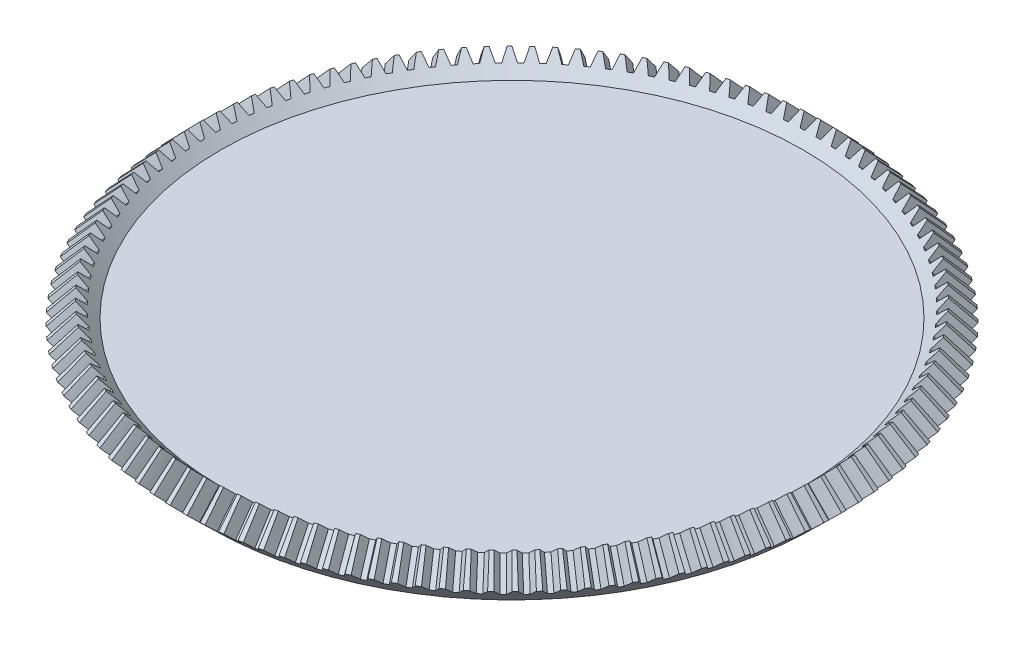
from build123d import *

# Parameters (mm, degrees)
CUT_EXTRUDE1_DEPTH = 12
CIRPATTERN1_COUNT  = 120


with BuildPart() as part:
    # Sketch11 → Revolve1 (revolve)
    with BuildSketch(Plane.XY):
        Polygon((-83.306834375, 124.691556476), (-88.919105998, 118.944462863), (-81.764617026, 111.957812196), (0, 111.957812196), (0, 120), (-78.615277899, 120), align=None)
    revolve(axis=Axis((0, 0, 0), (0, 1, 0)))

    # Sketch14 → Cut-Extrude1 (cut)
    with BuildSketch(Plane(origin=(0, 16.436731301, -16.051139385), x_dir=(1, 0, 0), z_dir=(0, 0.7154488971806515, -0.6986650667687555))):
        with BuildLine():
            ThreePointArc((-1.040586665, -143.469417413), (-0.552146737, -145.104616252), (0, -146.719417413))
            ThreePointArc((0, -146.719417413), (-1.710680658, -146.707922674), (-3.421052378, -146.673440534))
            ThreePointArc((-3.421052378, -146.673440534), (-2.825708993, -145.074060948), (-2.293501241, -143.452578997))
            ThreePointArc((-2.293501241, -143.452578997), (-1.667065213, -143.462580119), (-1.040586665, -143.469417413))
        make_face()
    cut_extrude1 = extrude(amount=CUT_EXTRUDE1_DEPTH, mode=Mode.SUBTRACT)

    # CirPattern1: Cut-Extrude1 ×120 about axis
    cirpattern1_axis = Axis((0, 118.944462863, 0), (0, -1, 0))
    for i in range(1, CIRPATTERN1_COUNT):
        add(cut_extrude1.rotate(cirpattern1_axis, i * 360 / CIRPATTERN1_COUNT), mode=Mode.SUBTRACT)


solid = part.part
